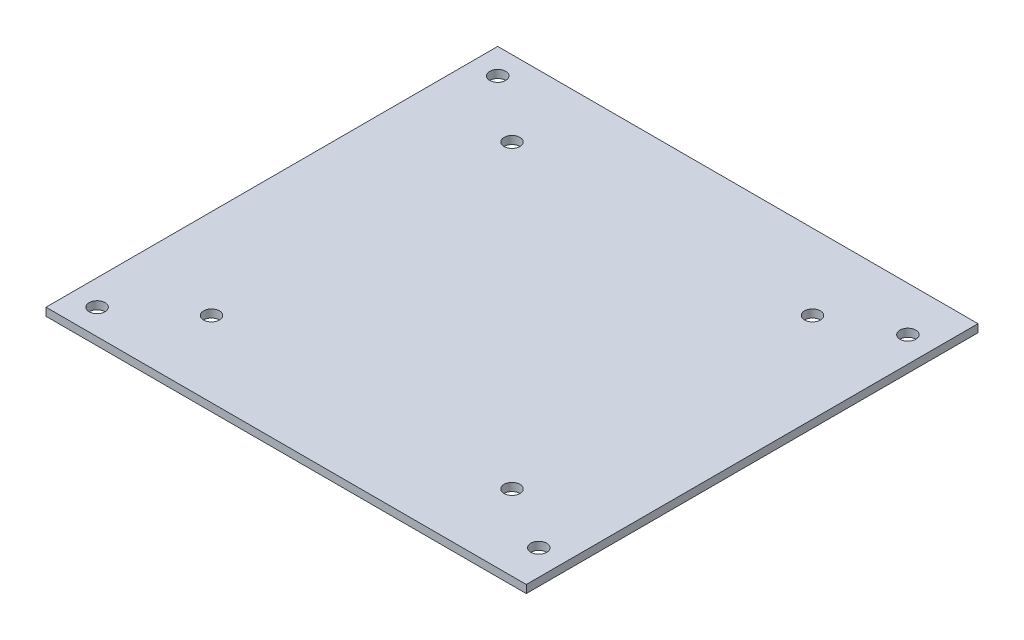
from build123d import *

# Parameters (mm, degrees)
SKETCH2_W           = 95.9
SKETCH2_H           = 90.2
SKETCH2_R           = 1.5875
BOSS_EXTRUDE1_DEPTH = 1.58


with BuildPart() as part:
    # Sketch2 → Boss-Extrude1 (new body)
    with BuildSketch(Plane(origin=(0, 0, 0), x_dir=(1, 0, 0), z_dir=(0, 1, 0))):
        Rectangle(SKETCH2_W, SKETCH2_H)
        with Locations((-42.85, -40)):
            Circle(SKETCH2_R, mode=Mode.SUBTRACT)
        with Locations((-30, -30)):
            Circle(SKETCH2_R, mode=Mode.SUBTRACT)
        with Locations((42.85, -37.5)):
            Circle(SKETCH2_R, mode=Mode.SUBTRACT)
        with Locations((30, -30)):
            Circle(SKETCH2_R, mode=Mode.SUBTRACT)
        with Locations((-30, 30)):
            Circle(SKETCH2_R, mode=Mode.SUBTRACT)
        with Locations((-42.85, 40)):
            Circle(SKETCH2_R, mode=Mode.SUBTRACT)
        with Locations((30, 30)):
            Circle(SKETCH2_R, mode=Mode.SUBTRACT)
        with Locations((42.85, 36.2)):
            Circle(SKETCH2_R, mode=Mode.SUBTRACT)
    extrude(amount=BOSS_EXTRUDE1_DEPTH)


solid = part.part
